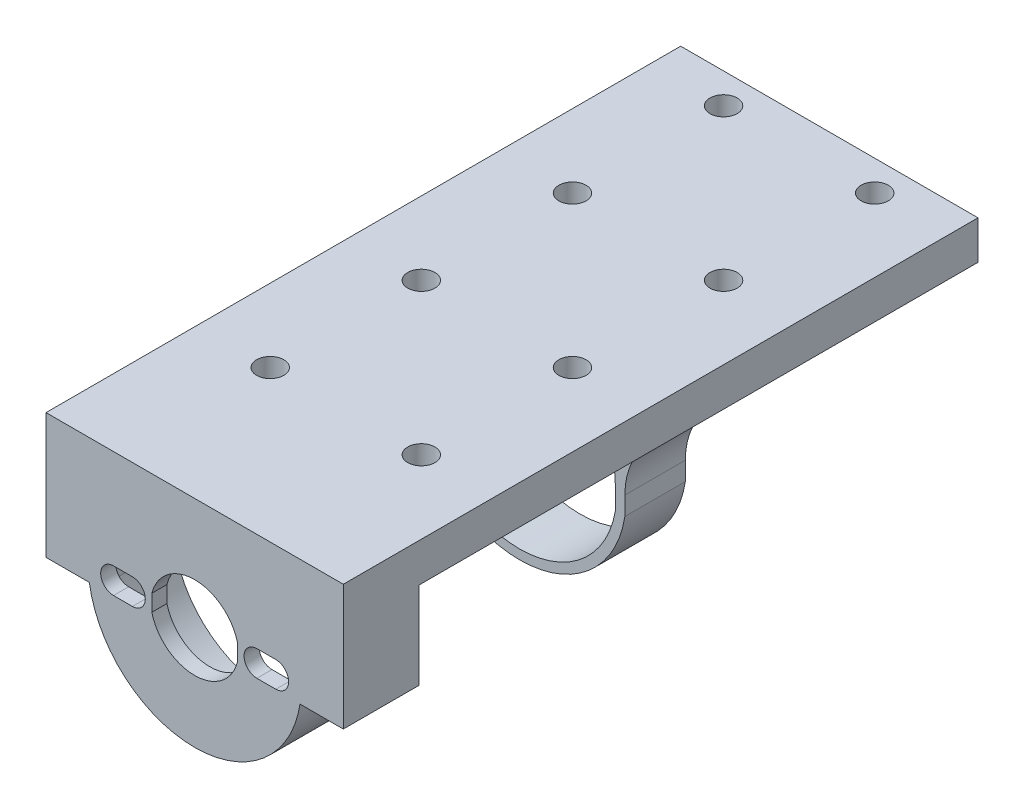
from build123d import *

# Parameters (mm, degrees)
BOSS_EXTRUDE1_DEPTH  = 10
BOSS_EXTRUDE3_DEPTH  = 10
BOSS_EXTRUDE4_START  = 74
BOSS_EXTRUDE4_DEPTH  = 74
M3_CLEARANCE_HOLE1_D = 3.6
LPATTERN1_COUNT      = 4
LPATTERN1_PITCH      = 20
BOSS_EXTRUDE6_START  = -2
BOSS_EXTRUDE6_DEPTH  = 2
BOSS_EXTRUDE7_START  = 8
BOSS_EXTRUDE7_DEPTH  = 8
FILLET1_R            = 10


with BuildPart() as part:
    # Sketch1 → Boss-Extrude1 (new body)
    with BuildSketch(Plane.XY):
        with BuildLine():
            Line((-13.941467283, 0), (-19.675, 0))
            Line((-19.675, 0), (-19.675, -1.8))
            Line((-19.675, -1.8), (-12.675, -1.8))
            Line((-12.675, -1.8), (-12.675, 0))
            ThreePointArc((-12.675, 0), (0, 10.693655384), (12.675, 0))
            Line((12.675, 0), (12.675, -1.8))
            Line((12.675, -1.8), (19.675, -1.8))
            Line((19.675, -1.8), (19.675, 0))
            Line((19.675, 0), (13.941467283, 0))
            ThreePointArc((13.941467283, 0), (0, 11.943655384), (-13.941467283, 0))
        make_face()
    boss_extrude1 = extrude(amount=BOSS_EXTRUDE1_DEPTH)

    # Mirror1: Boss-Extrude1 across plane
    add(boss_extrude1.mirror(Plane(origin=(-12.675, -1.8, 10), x_dir=(0, 0, 1), z_dir=(0, 1, 0))))

    # Sketch6 → Boss-Extrude3 (add)
    with BuildSketch(Plane(origin=(0, 0, 0), x_dir=(-1, 0, 0), z_dir=(0, 0, -1))):
        with BuildLine():
            Line((13.941467283, 0), (19.675, 0))
            Line((19.675, 0), (19.675, 13))
            Line((19.675, 13), (-19.675, 13))
            Line((-19.675, 13), (-19.675, 0))
            Line((-19.675, 0), (-13.941467283, 0))
            ThreePointArc((-13.941467283, 0), (0, 11.943655384), (13.941467283, 0))
        make_face()
    extrude(amount=-BOSS_EXTRUDE3_DEPTH)

    # Sketch15 → Boss-Extrude4 (add)
    with BuildSketch(Plane(origin=(0, 0, 0), x_dir=(-1, 0, 0), z_dir=(0, 0, -1)).offset(BOSS_EXTRUDE4_START)):
        with BuildLine():
            Line((8.007949472, 7.895675733), (19.675, 7.895675733))
            Line((19.675, 7.895675733), (19.675, 13))
            Line((19.675, 13), (-19.675, 13))
            Line((-19.675, 13), (-19.675, 7.895675733))
            Line((-19.675, 7.895675733), (-8.007949472, 7.895675733))
            ThreePointArc((-8.007949472, 7.895675733), (0, 10.693655384), (8.007949472, 7.895675733))
        make_face()
    extrude(amount=-BOSS_EXTRUDE4_DEPTH)

    # M3 Clearance Hole1 (through all)
    with Locations(Plane(origin=(0, 13, 0), x_dir=(1, 0, 0), z_dir=(0, 1, 0))):
        with Locations((-10, 10), (10, 10)):
            m3_clearance_hole1 = Hole(M3_CLEARANCE_HOLE1_D / 2)

    # LPattern1: M3 Clearance Hole1 ×4
    with Locations(*[(0, 0, -i * LPATTERN1_PITCH) for i in range(1, LPATTERN1_COUNT)]):
        add(m3_clearance_hole1, mode=Mode.SUBTRACT)

    # Sketch17 → Boss-Extrude6 (add)
    with BuildSketch(Plane.XY.offset(10).offset(BOSS_EXTRUDE6_START)):
        with BuildLine():
            Line((12.675, 0), (12.675, -3.6))
            ThreePointArc((12.675, -3.6), (0, -14.293655384), (-12.675, -3.6))
            Line((-12.675, -3.6), (-12.675, 0))
            ThreePointArc((-12.675, 0), (0, 10.693655384), (12.675, 0))
        make_face()
        with BuildLine():
            Line((5.675, -0.709896901), (5.675, -2.890103099))
            ThreePointArc((5.675, -2.890103099), (0, -7.293655384), (-5.675, -2.890103099))
            Line((-5.675, -2.890103099), (-5.675, -0.709896901))
            ThreePointArc((-5.675, -0.709896901), (0, 3.693655384), (5.675, -0.709896901))
        make_face(mode=Mode.SUBTRACT)
        with BuildLine():
            Line((-10.737300272, -0.1), (-8.237300272, -0.1))
            ThreePointArc((-8.237300272, -0.1), (-6.537300272, -1.8), (-8.237300272, -3.5))
            Line((-8.237300272, -3.5), (-10.737300272, -3.5))
            ThreePointArc((-10.737300272, -3.5), (-12.437300272, -1.8), (-10.737300272, -0.1))
        make_face(mode=Mode.SUBTRACT)
        with BuildLine():
            Line((10.737300272, -0.1), (8.237300272, -0.1))
            ThreePointArc((8.237300272, -0.1), (6.537300272, -1.8), (8.237300272, -3.5))
            Line((8.237300272, -3.5), (10.737300272, -3.5))
            ThreePointArc((10.737300272, -3.5), (12.437300272, -1.8), (10.737300272, -0.1))
        make_face(mode=Mode.SUBTRACT)
    extrude(amount=BOSS_EXTRUDE6_DEPTH)

    # Sketch18 → Boss-Extrude7 (add)
    with BuildSketch(Plane(origin=(0, 0, -33), x_dir=(-1, 0, 0), z_dir=(0, 0, -1)).offset(BOSS_EXTRUDE7_START)):
        with BuildLine():
            Line((12.675, -3.6), (12.675, 0))
            Line((12.675, 0), (12.675, 7.895675733))
            Line((12.675, 7.895675733), (13.841474736, 7.895675733))
            Line((13.841474736, 7.895675733), (13.941467283, -3.6))
            ThreePointArc((13.941467283, -3.6), (0, -15.543655384), (-13.941467283, -3.6))
            Line((-13.941467283, -3.6), (-13.941467283, 7.895675733))
            Line((-13.941467283, 7.895675733), (-12.675, 7.895675733))
            Line((-12.675, 7.895675733), (-12.675, 0))
            Line((-12.675, 0), (-12.675, -3.6))
            ThreePointArc((-12.675, -3.6), (0, -14.293655384), (12.675, -3.6))
        make_face()
    extrude(amount=-BOSS_EXTRUDE7_DEPTH)

    # Fillet1
    # the kernel refuses this fillet: 10 mm, written as the material it adds along each edge
    with BuildSketch(Plane(origin=(12.675, 7.895675733, -41), x_dir=(-1, 0, 0), z_dir=(0, 0, 1))) as fillet1_piece_1:
        with BuildLine():
            CenterArc((10, 8.459293702), FILLET1_R, 180, 57.771647339)
            Line((0, 8.459293702), (0, 0))
            Line((0, 0), (4.667050528, 0))
        make_face()
    extrude(amount=8)
    with BuildSketch(Plane(origin=(13.941467283, 7.895675733, -41), x_dir=(1, 0, 0), z_dir=(0, 0, 1))) as fillet1_piece_2:
        with BuildLine():
            CenterArc((10, -9.044183596), FILLET1_R, 115.254940541, 64.745059459)
            Line((0, -9.044183596), (0, 0))
            Line((0, 0), (5.733532717, 0))
        make_face()
    extrude(amount=8)
    with BuildSketch(Plane(origin=(-13.841474736, 7.895675733, -41), x_dir=(-1, 0, 0), z_dir=(0, 0, 1))) as fillet1_piece_3:
        with BuildLine():
            CenterArc((10.079132427, 9.053994688), FILLET1_R, 179.501638131, 65.375500513)
            Line((0.079510705, 9.140974146), (0, 0))
            Line((0, 0), (5.833525264, 0))
        make_face()
    extrude(amount=8)
    with BuildSketch(Plane(origin=(-12.675, 7.895675733, -41), x_dir=(1, 0, 0), z_dir=(0, 0, 1))) as fillet1_piece_4:
        with BuildLine():
            CenterArc((10, -8.459293702), FILLET1_R, 122.228352661, 57.771647339)
            Line((0, -8.459293702), (0, 0))
            Line((0, 0), (4.667050528, 0))
        make_face()
    extrude(amount=8)


solid = part.part
